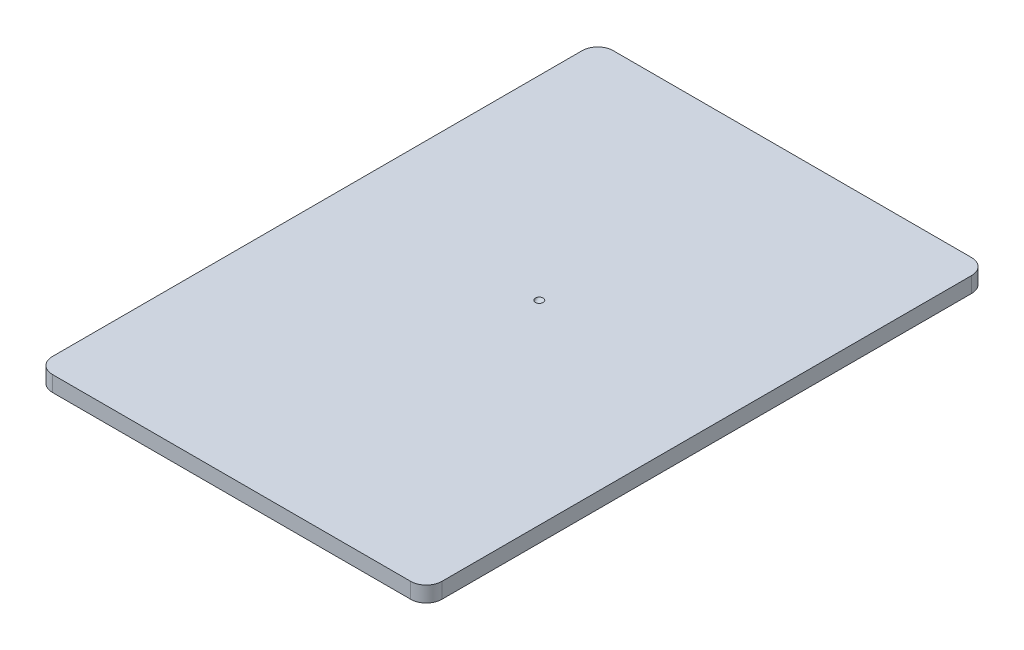
from build123d import *

# Parameters (mm, degrees)
PLATFORM_W                   = 50
PLATFORM_H                   = 72
PLATFORM_W_2                 = 22.5
PLATFORM_H_2                 = 43
PLATFORM_HEIGHT_DEPTH        = 2
TUBE_OUTER_DIAMETER_SKETCH_R = 1.5
TUBE_START                   = -6.464466201
TUBE_INNER_DIAMETER_DEPTH    = 10.707106612
FILLET1_R                    = 2


# Read off the part's stored shape, not the designer's step: Tube Inner Diameter
with BuildPart() as part:
    # Platform → Platform Height (new body)
    # profile 1 of 2: a face of its own
    with BuildSketch(Plane(origin=(0, 0, 0), x_dir=(1, 0, 0), z_dir=(0, 1, 0))):
        Rectangle(PLATFORM_W, PLATFORM_H)
        Rectangle(PLATFORM_W_2, PLATFORM_H_2, mode=Mode.SUBTRACT)
    # profile 2 of 2: a face of its own
    with BuildSketch(Plane(origin=(0, 0, 0), x_dir=(1, 0, 0), z_dir=(0, 1, 0))):
        Rectangle(PLATFORM_W_2, PLATFORM_H_2)
    extrude(amount=PLATFORM_HEIGHT_DEPTH)

    # Tube Outer Diameter: sweep along a curve in space
    with BuildLine() as tube_outer_diameter_path:
        Line((0, 2, -3.5), (0, -5.071067812, 3.571067812))
    # Tube Outer Diameter Sketch → Tube Outer Diameter (sweep)
    with BuildSketch(Plane(origin=(0, 2, 0), x_dir=(1, 0, 0), z_dir=(0, 1, 0))):
        with Locations((0, 3.5)):
            Circle(TUBE_OUTER_DIAMETER_SKETCH_R)
    sweep(path=tube_outer_diameter_path.line)

    # Tube Inner Diameter outline → Tube Inner Diameter (cut)
    with BuildSketch(Plane(origin=(0, 0, 0), x_dir=(1, 0, 0), z_dir=(0, 0.7071067811865487, -0.7071067811865464)).offset(TUBE_START)):
        with BuildLine():
            add(Edge.make_bspline(
                [(0, 0.707106781), (1, 0.707106781), (1, 1.414213562), (0, 1.414213562), (-1, 1.414213562), (-1, 0.707106781), (0, 0.707106781)],
                knots=[0, 0, 0, 0, 0.5, 0.5, 0.5, 1, 1, 1, 1], degree=3, weights=[1, 0.333333333, 0.333333333, 1, 0.333333333, 0.333333333, 1]))
        make_face()
    extrude(amount=TUBE_INNER_DIAMETER_DEPTH, mode=Mode.SUBTRACT)

    # Fillet1
    fillet1_edges = [part.edges().sort_by_distance(p)[0] for p in [
        (-25, 1, 36),
        (-25, 1, -36),
        (25, 1, -36),
        (25, 1, 36),
    ]]
    fillet(fillet1_edges, radius=FILLET1_R)


solid = part.part
